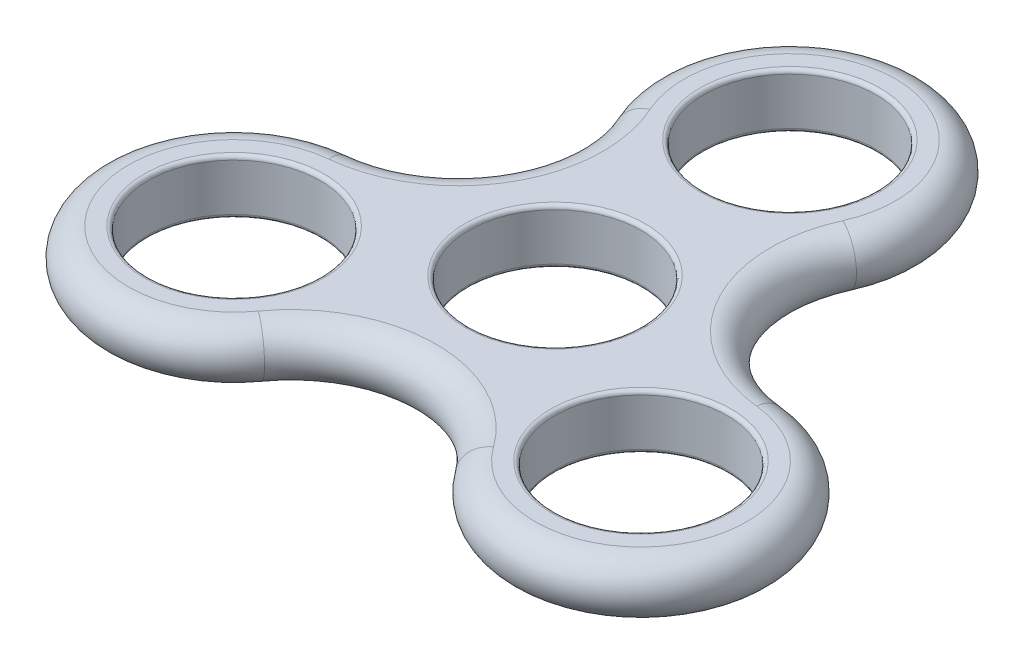
from build123d import *

# Parameters (mm, degrees)
SKETCH1_R           = 11
BOSS_EXTRUDE1_DEPTH = 7
FILLET1_R           = 3.5
FILLET2_R           = 0.5


with BuildPart() as part:
    # Sketch1 → Boss-Extrude1 (new body)
    with BuildSketch(Plane(origin=(0, 0, 0), x_dir=(1, 0, 0), z_dir=(0, 1, 0))):
        with BuildLine():
            ThreePointArc((15.496068833, 23.009159512), (0, 47), (-15.496068833, 23.009159512))
            ThreePointArc((-15.496068833, 23.009159512), (-16.178689687, 9.340770846), (-27.674551074, 1.915409512))
            ThreePointArc((-27.674551074, 1.915409512), (-40.703193978, -23.5), (-12.178482241, -24.924569024))
            ThreePointArc((-12.178482241, -24.924569024), (0, -18.681541692), (12.178482241, -24.924569024))
            ThreePointArc((12.178482241, -24.924569024), (40.703193978, -23.5), (27.674551074, 1.915409512))
            ThreePointArc((27.674551074, 1.915409512), (16.178689687, 9.340770846), (15.496068833, 23.009159512))
        make_face()
        with Locations(Location((0, 30, 0), (0, 0, 270))):
            Circle(SKETCH1_R, mode=Mode.SUBTRACT)
        with Locations(Location((0, 0, 0), (0, 0, 270))):
            Circle(SKETCH1_R, mode=Mode.SUBTRACT)
        with Locations(Location((-25.980762114, -15, 0), (0, 0, 270))):
            Circle(SKETCH1_R, mode=Mode.SUBTRACT)
        with Locations(Location((25.980762114, -15, 0), (0, 0, 270))):
            Circle(SKETCH1_R, mode=Mode.SUBTRACT)
    extrude(amount=BOSS_EXTRUDE1_DEPTH)

    # Fillet1
    fillet1_edges = [part.edges().sort_by_distance(p)[0] for p in [
        (-16.178689687, 7, -9.340770846),
        (16.178689687, 0, -9.340770846),
        (40.703193978, 0, 23.5),
        (0, 0, 18.681541692),
        (-40.703193978, 0, 23.5),
        (0, 0, -47),
    ]]
    fillet(fillet1_edges, radius=FILLET1_R - 0.0001)  # a hair under: the kernel refuses the full size

    # Fillet2
    fillet2_edges = [part.edges().sort_by_distance(p)[0] for p in [
        (-25.980762114, 0, 4),
        (25.980762114, 0, 4),
        (0, 0, -11),
        (0, 0, -41),
        (0, 7, -41),
        (0, 7, -11),
        (25.980762114, 7, 4),
        (-25.980762114, 7, 4),
    ]]
    fillet(fillet2_edges, radius=FILLET2_R)


solid = part.part
